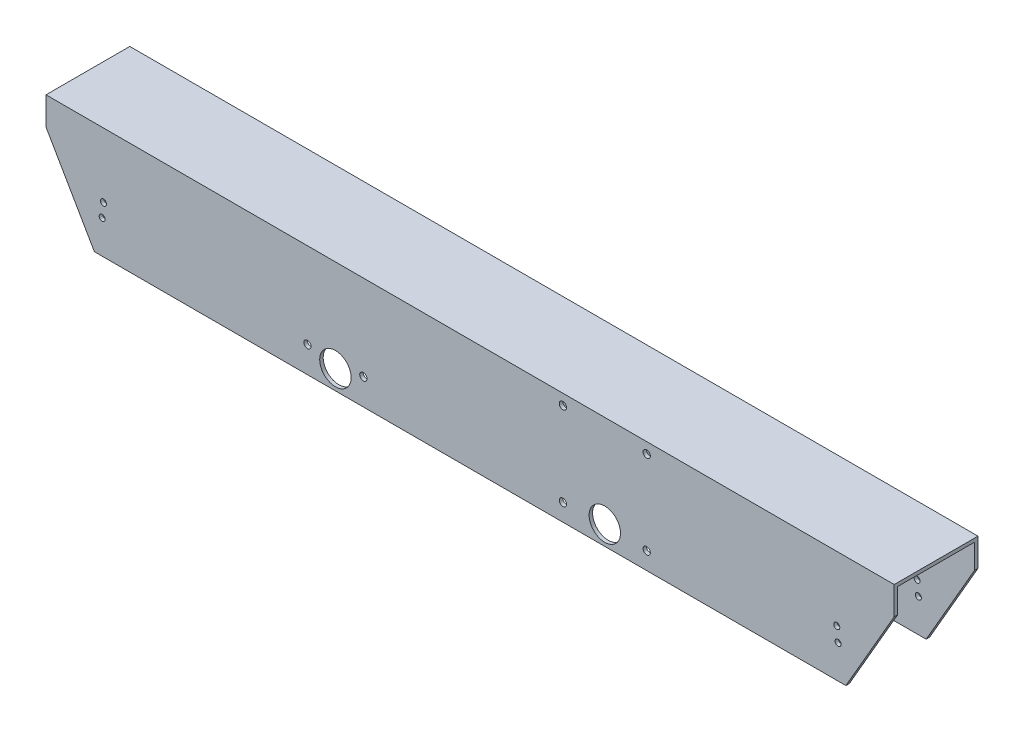
from build123d import *

# Parameters (mm, degrees)
BOSS_EXTRUDE1_DEPTH                     = 385.705756272
BEVELED_ENDS_DEPTH                      = 101.6
SKETCH2_R                               = 2.749999961
SKETCH2_R_2                             = 14.2875
SKETCH2_R_3                             = 2.75
SKETCH2_R_4                             = 3.302
AXLES_DEPTH                             = 141.732
FLANIGAN_MOUNTING_HOLES_R               = 3.3
FLANIGAN_MOUNTING_HOLES_EXTRUSION_DEPTH = 397.429073633


with BuildPart() as part:
    # Sketch1 → Boss-Extrude1 (new, symmetric)
    with BuildSketch(Plane(origin=(0, 0, 0), x_dir=(0, 0, -1), z_dir=(1, 0, 0))):
        Polygon((-38.1, 50.8), (38.1, 50.8), (38.1, -50.8), (34.925, -50.8), (34.925, 47.625), (-34.925, 47.625), (-34.925, -50.8), (-38.1, -50.8), align=None)
    extrude(amount=BOSS_EXTRUDE1_DEPTH, both=True)

    # Sketch16 → Beveled ends (cut)
    with BuildSketch(Plane.XY.offset(38.1)):
        Polygon((-385.705756272, 25.4), (-341.71166576, -50.8), (-385.705756272, -50.8), align=None)
        Polygon((341.71166576, -50.8), (385.705756272, -50.8), (385.705756272, 25.4), align=None)
    extrude(amount=-BEVELED_ENDS_DEPTH, mode=Mode.SUBTRACT)

    # Sketch2 → Axles (cut)
    with BuildSketch(Plane.XY.offset(38.1)):
        with Locations((-333.476515281, -7.874)):
            Circle(SKETCH2_R)
        with Locations((-122.5, -33.274)):
            Circle(SKETCH2_R_2)
        with Locations((334.620154629, -20.574)):
            Circle(SKETCH2_R_3)
        with Locations((333.476515281, -7.874)):
            Circle(SKETCH2_R)
        with Locations((84.4, -35.12)):
            Circle(SKETCH2_R_4)
        with Locations((84.4, 41.08)):
            Circle(SKETCH2_R_4)
        with Locations((122.5, -33.274)):
            Circle(SKETCH2_R_2)
        with Locations((-334.620154629, -20.574)):
            Circle(SKETCH2_R_3)
        with Locations((160.6, 41.08)):
            Circle(SKETCH2_R_4)
        with Locations((160.6, -35.12)):
            Circle(SKETCH2_R_4)
    extrude(amount=-AXLES_DEPTH, mode=Mode.SUBTRACT)

    # Flanigan mounting holes → Flanigan mounting holes extrusion (cut, through all)
    with BuildSketch(Plane.XY.offset(38.1)):
        with Locations((-147.9, -26.924)):
            Circle(FLANIGAN_MOUNTING_HOLES_R)
        with Locations((-97.1, -26.924)):
            Circle(FLANIGAN_MOUNTING_HOLES_R)
    extrude(amount=-FLANIGAN_MOUNTING_HOLES_EXTRUSION_DEPTH, mode=Mode.SUBTRACT)


solid = part.part
